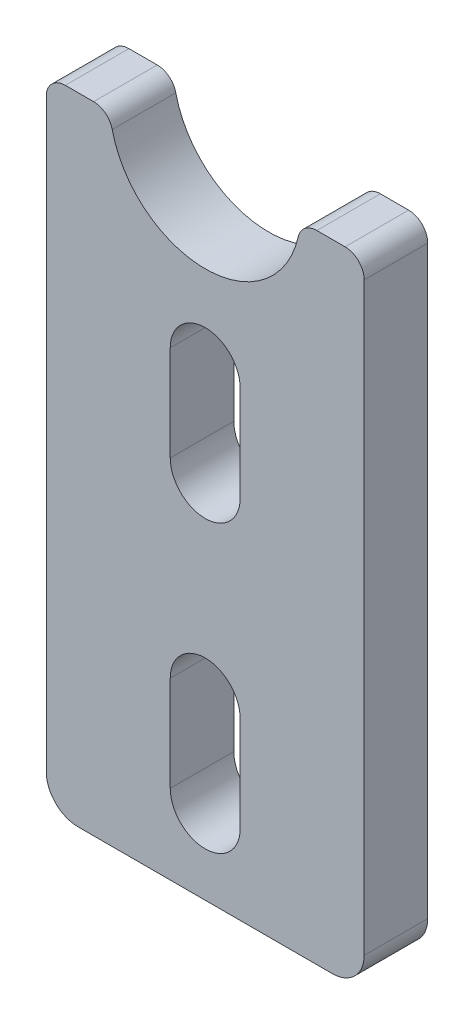
from build123d import *

# Parameters (mm, degrees)
IZIM1_W               = 50
IZIM1_H               = 100
TABAN_FLAN_1_DEPTH    = 10
KES_EKSTR_ZYON1_DEPTH = 20
RADYUS1_R             = 5
IZIM7_R               = 15
KES_EKSTR_ZYON2_DEPTH = 10
RADYUS2_R             = 3


# Sheet-metal steps are written as plain solids
with BuildPart() as part:
    # Çizim1 → Taban-Flanş1 (new body)
    with BuildSketch(Plane.XY):
        Rectangle(IZIM1_W, IZIM1_H)
    extrude(amount=-TABAN_FLAN_1_DEPTH)

    # Çizim6 → Kes-Ekstrüzyon1 (cut)
    with BuildSketch(Plane.XY):
        with BuildLine():
            Line((5.5, 22.5), (5.5, 7.5))
            ThreePointArc((5.5, 7.5), (0, 2), (-5.5, 7.5))
            Line((-5.5, 7.5), (-5.5, 22.5))
            ThreePointArc((-5.5, 22.5), (0, 28), (5.5, 22.5))
        make_face()
        with BuildLine():
            Line((-5.5, -37.5), (-5.5, -22.5))
            ThreePointArc((-5.5, -22.5), (0, -17), (5.5, -22.5))
            Line((5.5, -22.5), (5.5, -37.5))
            ThreePointArc((5.5, -37.5), (0, -43), (-5.5, -37.5))
        make_face()
    extrude(amount=-KES_EKSTR_ZYON1_DEPTH, mode=Mode.SUBTRACT)

    # Radyus1
    radyus1_edges = [part.edges().sort_by_distance(p)[0] for p in [
        (25, -50, -5),
        (-25, -50, -5),
    ]]
    fillet(radyus1_edges, radius=RADYUS1_R)

    # Çizim7 → Kes-Ekstrüzyon2 (cut)
    with BuildSketch(Plane.XY):
        with Locations((0, 51)):
            Circle(IZIM7_R)
    extrude(amount=-KES_EKSTR_ZYON2_DEPTH, mode=Mode.SUBTRACT)

    # Radyus2
    radyus2_edges = [part.edges().sort_by_distance(p)[0] for p in [
        (-14.966629547, 50, -5),
        (14.966629547, 50, -5),
        (-25, 50, -5),
        (25, 50, -5),
    ]]
    fillet(radyus2_edges, radius=RADYUS2_R)


solid = part.part
